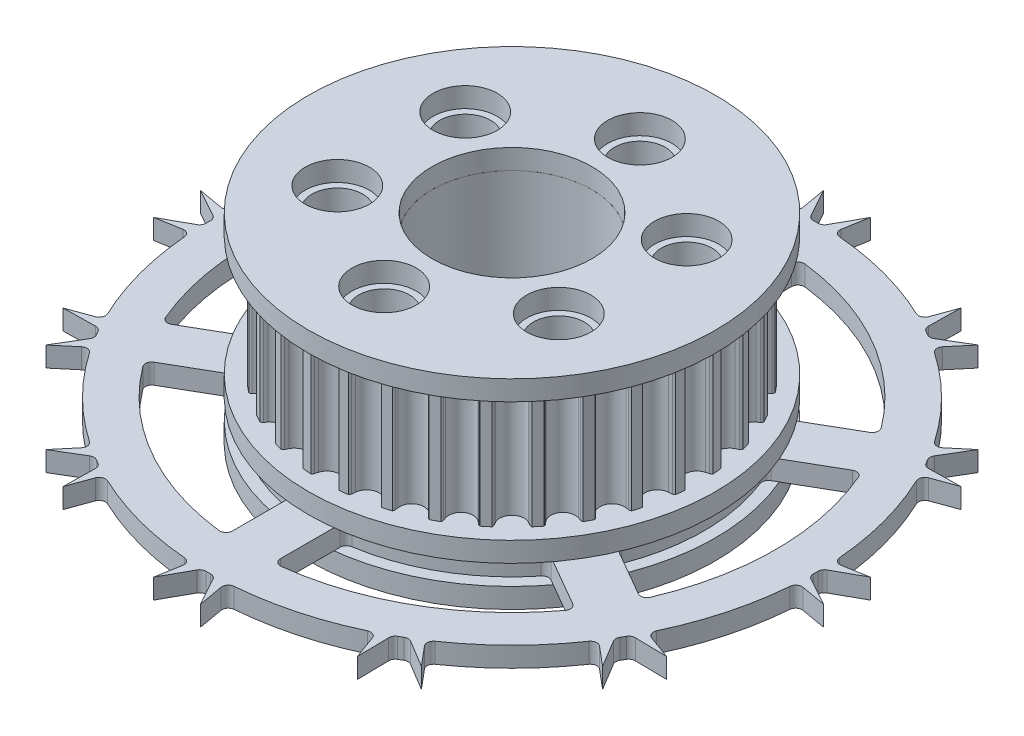
from build123d import *

# Parameters (mm, degrees)
SKETCH1_R                 = 14.897875026
TOOTHOD_DEPTH             = 4.7625
TOOTHPROFILE_DEPTH        = 22.600341822
TOOTHPATTERN_COUNT        = 32
BORE_DEPTH                = 22.542535823
BORE_DEPTH_BACK           = 22.542535823
SKETCH8_R                 = 16.167875026
SKETCH8_R_2               = 6.35
BOSS_EXTRUDE1_DEPTH       = 1.5875
SKETCH9_R                 = 2.0193
CUT_EXTRUDE1_DEPTH        = 27.155121214
SKETCH10_R                = 2.5527
CUT_EXTRUDE2_DEPTH        = 27.155121214
CIRPATTERN1_START         = -6.35
CIRPATTERN1_OUTLINE_R     = 2.0193
CIRPATTERN1_DEPTH         = 12.7
CIRPATTERN1_2_OUTLINE_R   = 2.5527
CIRPATTERN1_2_OUTLINE_R_2 = 2.0193
CIRPATTERN1_2_DEPTH       = 1.5875
CIRPATTERN1_START_2       = 4.7625
CIRPATTERN1_3_OUTLINE_R   = 2.5527
CIRPATTERN1_3_OUTLINE_R_2 = 2.0193
CIRPATTERN1_3_DEPTH       = 1.5875
SKETCH11_R                = 24.13
SKETCH11_R_2              = 6.35
BOSS_EXTRUDE2_DEPTH       = 1.5875
BOSS_EXTRUDE3_DEPTH       = 1.5875
FILLET1_R                 = 0.508
CIRPATTERN3_COUNT         = 12
FILLET1_OF_CIRPATTERN3_R  = 0.508
SKETCH13_R                = 2.5527
CUT_EXTRUDE3_DEPTH        = 41.246592919
FILLET2_R                 = 0.508
CIRPATTERN4_COUNT         = 6
FILLET2_OF_CIRPATTERN4_R  = 0.508


# Read off the part's stored shape, not the designer's step: CirPattern1
with BuildPart() as part:
    # Sketch1 → ToothOD (new, symmetric)
    with BuildSketch(Plane(origin=(0, 0, 0), x_dir=(1, 0, 0), z_dir=(0, 1, 0))):
        with Locations(Location((0, 0, 0), (0, 0, 90))):
            Circle(SKETCH1_R)
    extrude(amount=TOOTHOD_DEPTH, both=True)

    # Sketch2 → ToothProfile (cut, symmetric)
    with BuildSketch(Plane(origin=(0, 0, 0), x_dir=(1, 0, 0), z_dir=(0, 1, 0))):
        with BuildLine():
            ThreePointArc((-0.937033068, 14.447937022), (-0.590385173, 13.929762412), (0, 13.729475026))
            ThreePointArc((0, 13.729475026), (0.590385173, 13.929762412), (0.937033068, 14.447937022))
            ThreePointArc((0.937033068, 14.447937022), (0.971699064, 14.574048484), (1.007805813, 14.699755026))
            ThreePointArc((1.007805813, 14.699755026), (1.049505061, 14.78673532), (1.11667299, 14.855965863))
            ThreePointArc((1.11667299, 14.855965863), (0, 14.897875026), (-1.11667299, 14.855965863))
            ThreePointArc((-1.11667299, 14.855965863), (-1.049505061, 14.78673532), (-1.007805813, 14.699755026))
            ThreePointArc((-1.007805813, 14.699755026), (-0.971699064, 14.574048484), (-0.937033068, 14.447937022))
        make_face()
    toothprofile = extrude(amount=TOOTHPROFILE_DEPTH, both=True, mode=Mode.SUBTRACT)

    # ToothPattern: ToothProfile ×32 about axis
    toothpattern_axis = Axis((0, 0, 0), (0, 1, 0))
    for i in range(1, TOOTHPATTERN_COUNT):
        add(toothprofile.rotate(toothpattern_axis, i * 360 / TOOTHPATTERN_COUNT), mode=Mode.SUBTRACT)

    # Sketch7 → Bore (cut, two sides: drawn at the far end of the back side and taken through both)
    with BuildSketch(Plane.XZ.offset(-BORE_DEPTH_BACK)):
        with BuildLine():
            ThreePointArc((2.767900829, -5.715), (0, 6.35), (-2.767900829, -5.715))
            ThreePointArc((-2.767900829, -5.715), (0, -6.35), (2.767900829, -5.715))
        make_face()
    extrude(amount=BORE_DEPTH + BORE_DEPTH_BACK, mode=Mode.SUBTRACT)


with BuildPart() as body_2:
    # Sketch8 → Boss-Extrude1 (new body)
    with BuildSketch(Plane(origin=(0, -4.7625, 0), x_dir=(1, 0, 0), z_dir=(0, 1, 0))):
        with Locations(Location((0, 0, 0), (0, 0, 270))):
            Circle(SKETCH8_R)
        with Locations(Location((0, 0, 0), (0, 0, 270))):
            Circle(SKETCH8_R_2, mode=Mode.SUBTRACT)
    extrude(amount=-BOSS_EXTRUDE1_DEPTH)


with BuildPart() as body_3:
    # Mirror1: mirrored copy
    add(body_2.part.mirror(Plane.ZX))


with BuildPart() as cut_extrude1_tool:
    # Sketch9 → Cut-Extrude1 (new, through all)
    with BuildSketch(Plane.XZ.offset(6.35)):
        with Locations(Location((0, 10.16, 0), (0, 0, 270))):
            Circle(SKETCH9_R)
    extrude(amount=-CUT_EXTRUDE1_DEPTH)


with BuildPart() as part_1:
    add(part.part)

    # Cut-Extrude1: cut by cut_extrude1_tool
    add(cut_extrude1_tool.part, mode=Mode.SUBTRACT)


with BuildPart() as body_2_1:
    add(body_2.part)

    # Cut-Extrude1: cut by cut_extrude1_tool
    add(cut_extrude1_tool.part, mode=Mode.SUBTRACT)


with BuildPart() as body_3_1:
    add(body_3.part)

    # Cut-Extrude1: cut by cut_extrude1_tool
    add(cut_extrude1_tool.part, mode=Mode.SUBTRACT)


with BuildPart() as cut_extrude2_tool:
    # Sketch10 → Cut-Extrude2 (new, through all)
    with BuildSketch(Plane.XZ.offset(6.35)):
        with Locations(Location((0, 10.16, 0), (0, 0, 270))):
            Circle(SKETCH10_R)
    extrude(amount=-CUT_EXTRUDE2_DEPTH)


with BuildPart() as body_2_2:
    add(body_2_1.part)

    # Cut-Extrude2: cut by cut_extrude2_tool
    add(cut_extrude2_tool.part, mode=Mode.SUBTRACT)


with BuildPart() as body_3_2:
    add(body_3_1.part)

    # Cut-Extrude2: cut by cut_extrude2_tool
    add(cut_extrude2_tool.part, mode=Mode.SUBTRACT)


with BuildPart() as cirpattern1_tool:
    # CirPattern1 outline → CirPattern1 (new body)
    with BuildSketch(Plane(origin=(0, 0, 0), x_dir=(1, 0, 0), z_dir=(0, 1, 0)).offset(CIRPATTERN1_START)):
        with Locations((-8.798818102, -5.08)):
            Circle(CIRPATTERN1_OUTLINE_R)
        with Locations((-8.798818102, 5.08)):
            Circle(CIRPATTERN1_OUTLINE_R)
        with Locations((0, 10.16)):
            Circle(CIRPATTERN1_OUTLINE_R)
        with Locations((8.798818102, 5.08)):
            Circle(CIRPATTERN1_OUTLINE_R)
        with Locations((8.798818102, -5.08)):
            Circle(CIRPATTERN1_OUTLINE_R)
    extrude(amount=CIRPATTERN1_DEPTH)


with BuildPart() as part_2:
    add(part_1.part)

    # CirPattern1: cut by cirpattern1_tool
    add(cirpattern1_tool.part, mode=Mode.SUBTRACT)


with BuildPart() as body_2_3:
    add(body_2_2.part)

    # CirPattern1: cut by cirpattern1_tool
    add(cirpattern1_tool.part, mode=Mode.SUBTRACT)

    # CirPattern1 2 outline → CirPattern1 2 (cut)
    # profile 1 of 5: a face of its own
    with BuildSketch(Plane(origin=(0, 0, 0), x_dir=(1, 0, 0), z_dir=(0, 1, 0)).offset(CIRPATTERN1_START)):
        with Locations((-8.798818102, -5.08)):
            Circle(CIRPATTERN1_2_OUTLINE_R)
        with Locations((-8.798818102, -5.08)):
            Circle(CIRPATTERN1_2_OUTLINE_R_2, mode=Mode.SUBTRACT)
    # profile 2 of 5: a face of its own
    with BuildSketch(Plane(origin=(0, 0, 0), x_dir=(1, 0, 0), z_dir=(0, 1, 0)).offset(CIRPATTERN1_START)):
        with Locations((-8.798818102, 5.08)):
            Circle(CIRPATTERN1_2_OUTLINE_R)
        with Locations((-8.798818102, 5.08)):
            Circle(CIRPATTERN1_2_OUTLINE_R_2, mode=Mode.SUBTRACT)
    # profile 3 of 5: a face of its own
    with BuildSketch(Plane(origin=(0, 0, 0), x_dir=(1, 0, 0), z_dir=(0, 1, 0)).offset(CIRPATTERN1_START)):
        with Locations((0, 10.16)):
            Circle(CIRPATTERN1_2_OUTLINE_R)
        with Locations((0, 10.16)):
            Circle(CIRPATTERN1_2_OUTLINE_R_2, mode=Mode.SUBTRACT)
    # profile 4 of 5: a face of its own
    with BuildSketch(Plane(origin=(0, 0, 0), x_dir=(1, 0, 0), z_dir=(0, 1, 0)).offset(CIRPATTERN1_START)):
        with Locations((8.798818102, 5.08)):
            Circle(CIRPATTERN1_2_OUTLINE_R)
        with Locations((8.798818102, 5.08)):
            Circle(CIRPATTERN1_2_OUTLINE_R_2, mode=Mode.SUBTRACT)
    # profile 5 of 5: a face of its own
    with BuildSketch(Plane(origin=(0, 0, 0), x_dir=(1, 0, 0), z_dir=(0, 1, 0)).offset(CIRPATTERN1_START)):
        with Locations((8.798818102, -5.08)):
            Circle(CIRPATTERN1_2_OUTLINE_R)
        with Locations((8.798818102, -5.08)):
            Circle(CIRPATTERN1_2_OUTLINE_R_2, mode=Mode.SUBTRACT)
    extrude(amount=CIRPATTERN1_2_DEPTH, mode=Mode.SUBTRACT)


with BuildPart() as body_3_3:
    add(body_3_2.part)

    # CirPattern1: cut by cirpattern1_tool
    add(cirpattern1_tool.part, mode=Mode.SUBTRACT)

    # CirPattern1 3 outline → CirPattern1 3 (cut)
    # profile 1 of 5: a face of its own
    with BuildSketch(Plane(origin=(0, 0, 0), x_dir=(1, 0, 0), z_dir=(0, 1, 0)).offset(CIRPATTERN1_START_2)):
        with Locations((-8.798818102, -5.08)):
            Circle(CIRPATTERN1_3_OUTLINE_R)
        with Locations((-8.798818102, -5.08)):
            Circle(CIRPATTERN1_3_OUTLINE_R_2, mode=Mode.SUBTRACT)
    # profile 2 of 5: a face of its own
    with BuildSketch(Plane(origin=(0, 0, 0), x_dir=(1, 0, 0), z_dir=(0, 1, 0)).offset(CIRPATTERN1_START_2)):
        with Locations((-8.798818102, 5.08)):
            Circle(CIRPATTERN1_3_OUTLINE_R)
        with Locations((-8.798818102, 5.08)):
            Circle(CIRPATTERN1_3_OUTLINE_R_2, mode=Mode.SUBTRACT)
    # profile 3 of 5: a face of its own
    with BuildSketch(Plane(origin=(0, 0, 0), x_dir=(1, 0, 0), z_dir=(0, 1, 0)).offset(CIRPATTERN1_START_2)):
        with Locations((0, 10.16)):
            Circle(CIRPATTERN1_3_OUTLINE_R)
        with Locations((0, 10.16)):
            Circle(CIRPATTERN1_3_OUTLINE_R_2, mode=Mode.SUBTRACT)
    # profile 4 of 5: a face of its own
    with BuildSketch(Plane(origin=(0, 0, 0), x_dir=(1, 0, 0), z_dir=(0, 1, 0)).offset(CIRPATTERN1_START_2)):
        with Locations((8.798818102, 5.08)):
            Circle(CIRPATTERN1_3_OUTLINE_R)
        with Locations((8.798818102, 5.08)):
            Circle(CIRPATTERN1_3_OUTLINE_R_2, mode=Mode.SUBTRACT)
    # profile 5 of 5: a face of its own
    with BuildSketch(Plane(origin=(0, 0, 0), x_dir=(1, 0, 0), z_dir=(0, 1, 0)).offset(CIRPATTERN1_START_2)):
        with Locations((8.798818102, -5.08)):
            Circle(CIRPATTERN1_3_OUTLINE_R)
        with Locations((8.798818102, -5.08)):
            Circle(CIRPATTERN1_3_OUTLINE_R_2, mode=Mode.SUBTRACT)
    extrude(amount=CIRPATTERN1_3_DEPTH, mode=Mode.SUBTRACT)


with BuildPart() as body_4:
    # Sketch11 → Boss-Extrude2 (new body)
    with BuildSketch(Plane.XZ.offset(6.35)):
        with Locations(Location((0, 0, 0), (0, 0, 270))):
            Circle(SKETCH11_R)
        with Locations(Location((0, 0, 0), (0, 0, 270))):
            Circle(SKETCH11_R_2, mode=Mode.SUBTRACT)
    extrude(amount=BOSS_EXTRUDE2_DEPTH)

    # Sketch12 → Boss-Extrude3 (add)
    with BuildSketch(Plane.XZ.offset(7.9375)):
        Polygon((1.860405155, 26.60503322), (1.416651103, 24.088378934), (0.485761306, 24.125110071), align=None)
        Polygon((-1.416651103, 24.088378934), (-0.485761306, 24.125110071), (-1.860405155, 26.60503322), align=None)
    boss_extrude3 = extrude(amount=-BOSS_EXTRUDE3_DEPTH)

    # Fillet1
    fillet1_edges = [body_4.edges().sort_by_distance(p)[0] for p in [
        (1.416651103, -7.14375, 24.088378934),
        (0.485761306, -7.14375, 24.125110071),
        (-0.485761306, -7.14375, 24.125110071),
        (-1.416651103, -7.14375, 24.088378934),
    ]]
    fillet(fillet1_edges, radius=FILLET1_R)

    # CirPattern3: Boss-Extrude3 ×12 about axis
    cirpattern3_axis = Axis((0, 0, 0), (0, 1, 0))
    for i in range(1, CIRPATTERN3_COUNT):
        add(boss_extrude3.rotate(cirpattern3_axis, i * 360 / CIRPATTERN3_COUNT))

    # Fillet1 of CirPattern3
    fillet1_of_cirpattern3_edges = [body_4.edges().sort_by_distance(p)[0] for p in [
        (13.27104531, -7.14375, 20.152822541),
        (12.483236667, -7.14375, 20.650077538),
        (11.641873404, -7.14375, 21.135838844),
        (10.817333623, -7.14375, 21.569473644),
        (21.569473644, -7.14375, 10.817333623),
        (21.135838844, -7.14375, 11.641873404),
        (20.650077538, -7.14375, 12.483236667),
        (20.152822541, -7.14375, 13.27104531),
        (24.088378934, -7.14375, -1.416651103),
        (24.125110071, -7.14375, -0.485761306),
        (24.125110071, -7.14375, 0.485761306),
        (24.088378934, -7.14375, 1.416651103),
        (20.152822541, -7.14375, -13.27104531),
        (20.650077538, -7.14375, -12.483236667),
        (21.135838844, -7.14375, -11.641873404),
        (21.569473644, -7.14375, -10.817333623),
        (10.817333623, -7.14375, -21.569473644),
        (11.641873404, -7.14375, -21.135838844),
        (12.483236667, -7.14375, -20.650077538),
        (13.27104531, -7.14375, -20.152822541),
        (-1.416651103, -7.14375, -24.088378934),
        (-0.485761306, -7.14375, -24.125110071),
        (0.485761306, -7.14375, -24.125110071),
        (1.416651103, -7.14375, -24.088378934),
        (-13.27104531, -7.14375, -20.152822541),
        (-12.483236667, -7.14375, -20.650077538),
        (-11.641873404, -7.14375, -21.135838844),
        (-10.817333623, -7.14375, -21.569473644),
        (-21.569473644, -7.14375, -10.817333623),
        (-21.135838844, -7.14375, -11.641873404),
        (-20.650077538, -7.14375, -12.483236667),
        (-20.152822541, -7.14375, -13.27104531),
        (-24.088378934, -7.14375, 1.416651103),
        (-24.125110071, -7.14375, 0.485761306),
        (-24.125110071, -7.14375, -0.485761306),
        (-24.088378934, -7.14375, -1.416651103),
        (-20.152822541, -7.14375, 13.27104531),
        (-20.650077538, -7.14375, 12.483236667),
        (-21.135838844, -7.14375, 11.641873404),
        (-21.569473644, -7.14375, 10.817333623),
        (-10.817333623, -7.14375, 21.569473644),
        (-11.641873404, -7.14375, 21.135838844),
        (-12.483236667, -7.14375, 20.650077538),
        (-13.27104531, -7.14375, 20.152822541),
    ]]
    fillet(fillet1_of_cirpattern3_edges, radius=FILLET1_OF_CIRPATTERN3_R)

    # Sketch13 → Cut-Extrude3 (cut, through all)
    with BuildSketch(Plane.XZ.offset(7.9375)):
        with Locations(Location((0, 10.16, 0), (0, 0, 270))):
            Circle(SKETCH13_R)
        with BuildLine():
            Line((1.905, 20.868229441), (1.905, 15.120468743))
            ThreePointArc((1.905, 15.120468743), (7.62, 13.198227154), (12.142210048, 9.210012766))
            Line((12.142210048, 9.210012766), (17.119916828, 12.083893115))
            ThreePointArc((17.119916828, 12.083893115), (10.4775, 18.147562336), (1.905, 20.868229441))
        make_face()
    cut_extrude3 = extrude(amount=-CUT_EXTRUDE3_DEPTH, mode=Mode.SUBTRACT)

    # Fillet2
    fillet2_edges = [body_4.edges().sort_by_distance(p)[0] for p in [
        (1.905, -7.14375, 20.868229441),
        (17.119916828, -7.14375, 12.083893115),
        (12.142210048, -7.14375, 9.210012766),
        (1.905, -7.14375, 15.120468743),
    ]]
    fillet(fillet2_edges, radius=FILLET2_R)

    # CirPattern4: Cut-Extrude3 ×6 about axis
    cirpattern4_axis = Axis((0, 0, 0), (0, 1, 0))
    for i in range(1, CIRPATTERN4_COUNT):
        add(cut_extrude3.rotate(cirpattern4_axis, i * 360 / CIRPATTERN4_COUNT), mode=Mode.SUBTRACT)

    # Fillet2 of CirPattern4
    fillet2_of_cirpattern4_edges = [body_4.edges().sort_by_distance(p)[0] for p in [
        (19.024916828, -7.14375, 8.784336326),
        (19.024916828, -7.14375, -8.784336326),
        (14.047210048, -7.14375, -5.910455977),
        (14.047210048, -7.14375, 5.910455977),
        (17.119916828, -7.14375, -12.083893115),
        (1.905, -7.14375, -20.868229441),
        (1.905, -7.14375, -15.120468743),
        (12.142210048, -7.14375, -9.210012766),
        (-1.905, -7.14375, -20.868229441),
        (-17.119916828, -7.14375, -12.083893115),
        (-12.142210048, -7.14375, -9.210012766),
        (-1.905, -7.14375, -15.120468743),
        (-19.024916828, -7.14375, -8.784336326),
        (-19.024916828, -7.14375, 8.784336326),
        (-14.047210048, -7.14375, 5.910455977),
        (-14.047210048, -7.14375, -5.910455977),
        (-17.119916828, -7.14375, 12.083893115),
        (-1.905, -7.14375, 20.868229441),
        (-1.905, -7.14375, 15.120468743),
        (-12.142210048, -7.14375, 9.210012766),
    ]]
    fillet(fillet2_of_cirpattern4_edges, radius=FILLET2_OF_CIRPATTERN4_R)


with BuildPart() as body_5:
    # Mirror2: mirrored copy
    add(body_2_3.part.mirror(Plane(origin=(0, -7.14375, 0), x_dir=(0, 0, 1), z_dir=(0, -1, 0))))


solid = Compound([part_2.part, body_2_3.part, body_3_3.part, body_4.part, body_5.part])
